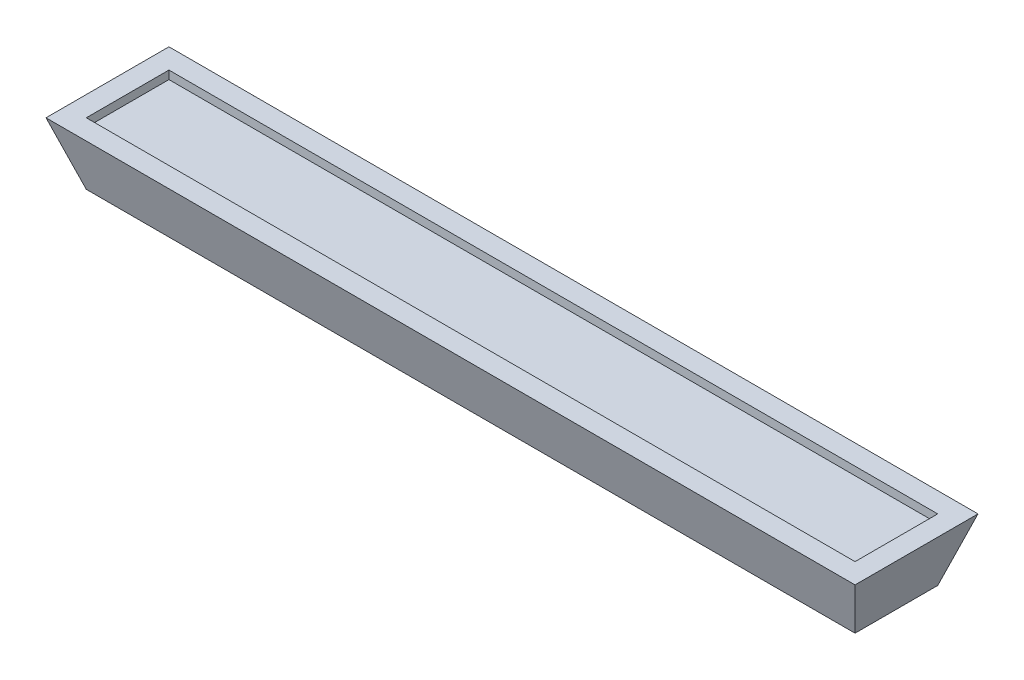
from build123d import *

# Parameters (mm, degrees)
SKETCH_1_W          = 186
SKETCH_1_H          = 20
EXTRUDE_1_DEPTH     = 15
EXTRUDE_1_DRAFT     = -18
SKETCH_2_W          = 186
SKETCH_2_H          = 20
CUT_EXTRUDE_2_DEPTH = 2
SKETCH_3_W          = 177
SKETCH_3_H          = 11
CUT_EXTRUDE_3_DEPTH = 4
SKETCH_4_R          = 2.75
CUT_EXTRUDE_6_DEPTH = 5.5


with BuildPart() as part:
    # 草图1 → 凸台-拉伸1 (with draft: the straight prism first)
    with BuildSketch(Plane(origin=(0, 0, 0), x_dir=(1, 0, 0), z_dir=(0, 1, 0))):
        Rectangle(SKETCH_1_W, SKETCH_1_H)
    extrude(amount=EXTRUDE_1_DEPTH)
    # 凸台-拉伸1: the draft: its side faces are tilted about the plane it starts from
    extrude_1_sides = [part.faces().sort_by_distance(p)[0] for p in [
        (-93, 7.5, 0),
        (0, 7.5, 10),
        (93, 7.5, 0),
        (0, 7.5, -10),
    ]]
    draft(extrude_1_sides, Plane(origin=(0, 0, 0), x_dir=(1, 0, 0), z_dir=(0, 1, 0)), EXTRUDE_1_DRAFT)

    # 草图2 → 切除-拉伸2 (cut)
    with BuildSketch(Plane(origin=(0, 15, 0), x_dir=(1, 0, 0), z_dir=(0, 1, 0))):
        Rectangle(SKETCH_2_W, SKETCH_2_H)
    extrude(amount=-CUT_EXTRUDE_2_DEPTH, mode=Mode.SUBTRACT)

    # 草图3 → 切除-拉伸3 (cut)
    with BuildSketch(Plane.XZ):
        Rectangle(SKETCH_3_W, SKETCH_3_H)
    extrude(amount=-CUT_EXTRUDE_3_DEPTH, mode=Mode.SUBTRACT)

    # 草图4 → 切除-拉伸6 (cut)
    with BuildSketch(Plane.XZ.offset(-4)):
        with Locations((-72, 0)):
            Circle(SKETCH_4_R)
        with Locations((-38, 0)):
            Circle(SKETCH_4_R)
        with Locations((38, 0)):
            Circle(SKETCH_4_R)
        with Locations((72, 0)):
            Circle(SKETCH_4_R)
    extrude(amount=-CUT_EXTRUDE_6_DEPTH, mode=Mode.SUBTRACT)


solid = part.part
